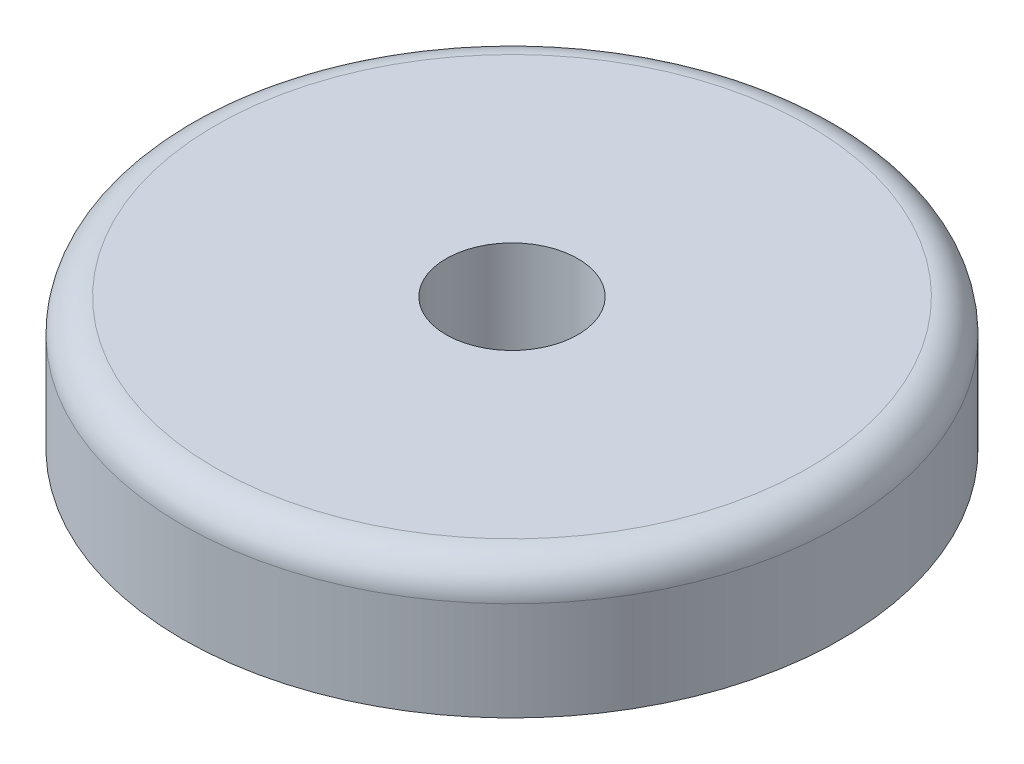
from build123d import *

# Parameters (mm, degrees)
SKETCH1_R           = 5
BOSS_EXTRUDE1_DEPTH = 2
SKETCH2_R           = 1
CUT_EXTRUDE1_DEPTH  = 12.5
FILLET1_R           = 0.5


with BuildPart() as part:
    # Sketch1 → Boss-Extrude1 (new body)
    with BuildSketch(Plane(origin=(0, 0, 0), x_dir=(1, 0, 0), z_dir=(0, 1, 0))):
        Circle(SKETCH1_R)
    extrude(amount=BOSS_EXTRUDE1_DEPTH)

    # Sketch2 → Cut-Extrude1 (cut)
    with BuildSketch(Plane(origin=(0, 2, 0), x_dir=(1, 0, 0), z_dir=(0, 1, 0))):
        Circle(SKETCH2_R)
    extrude(amount=-CUT_EXTRUDE1_DEPTH, mode=Mode.SUBTRACT)

    # Fillet1
    fillet1_edges = [part.edges().sort_by_distance(p)[0] for p in [
        (-5, 2, 0),
    ]]
    fillet(fillet1_edges, radius=FILLET1_R)


solid = part.part
